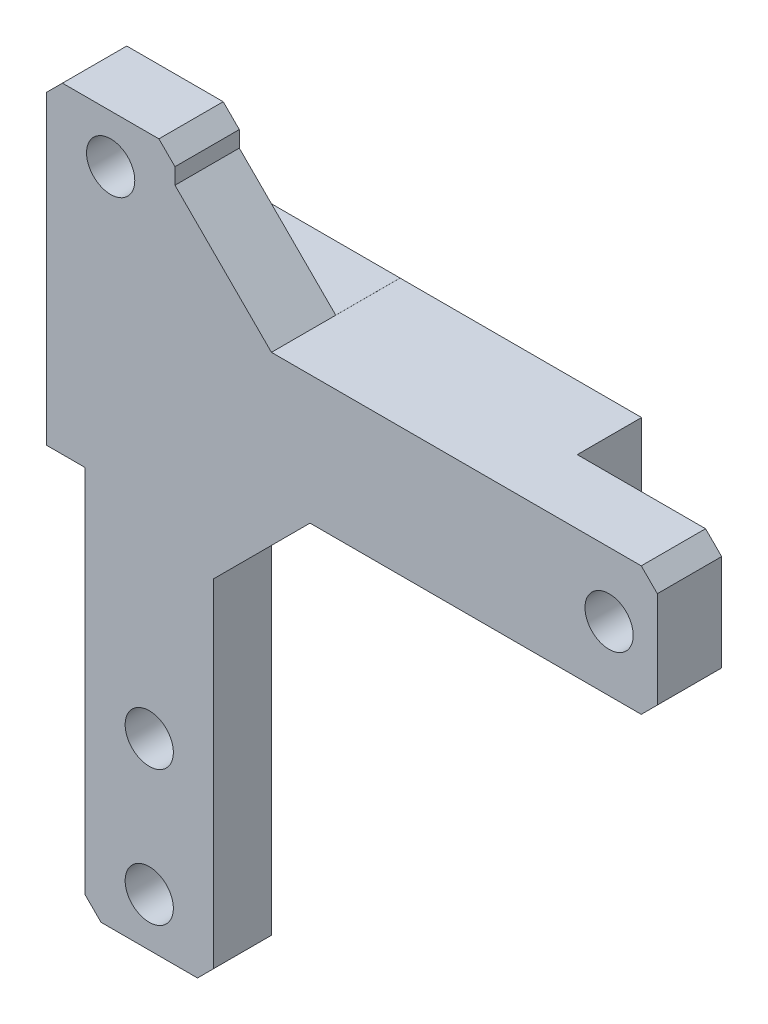
from build123d import *

# Parameters (mm, degrees)
SKETCH_1_R          = 0.75
EXTRUDE_1_DEPTH     = 4
SKETCH_2_W          = 4
SKETCH_2_H          = 11.631287185
SKETCH_2_R          = 0.75
CUT_EXTRUDE_1_DEPTH = 2.2
SKETCH_3_W          = 4.48994314
SKETCH_3_H          = 4
SKETCH_3_R          = 0.75
SKETCH_3_W_2        = 4
SKETCH_3_H_2        = 3.998874997
CUT_EXTRUDE_2_DEPTH = 2
CHAMFER_1_SIZE      = 3
CHAMFER_2_SIZE      = 0.5


with BuildPart() as part:
    # 草图1 → 凸台-拉伸1 (new body)
    with BuildSketch(Plane.XY):
        Polygon((-4.3, -2.5), (9.5, -2.5), (9.5, 1.5), (-5.5, 1.5), (-5.5, 5.5), (-9.5, 5.5), (-9.5, 1.5), (-9.5, -4.5), (-8.3, -4.5), (-8.3, -16.5), (-4.3, -16.5), align=None)
        with Locations((8, -0.5)):
            Circle(SKETCH_1_R, mode=Mode.SUBTRACT)
        with Locations((-7.5, 4)):
            Circle(SKETCH_1_R, mode=Mode.SUBTRACT)
        with Locations((-6.3, -15)):
            Circle(SKETCH_1_R, mode=Mode.SUBTRACT)
        with Locations((-6.3, -10.8)):
            Circle(SKETCH_1_R, mode=Mode.SUBTRACT)
    extrude(amount=EXTRUDE_1_DEPTH)

    # 草图2 → 切除-拉伸1 (cut)
    with BuildSketch(Plane.XY):
        with Locations((-6.3, -10.684356408)):
            Rectangle(SKETCH_2_W, SKETCH_2_H)
        with Locations((-6.3, -15)):
            Circle(SKETCH_2_R, mode=Mode.SUBTRACT)
        with Locations((-6.3, -10.8)):
            Circle(SKETCH_2_R, mode=Mode.SUBTRACT)
    extrude(amount=CUT_EXTRUDE_1_DEPTH, mode=Mode.SUBTRACT)

    # 草图3 → 切除-拉伸2 (cut)
    # profile 1 of 2: a face of its own
    with BuildSketch(Plane(origin=(0, 0, 0), x_dir=(-1, 0, 0), z_dir=(0, 0, -1))):
        with Locations((-7.25502843, -0.5)):
            Rectangle(SKETCH_3_W, SKETCH_3_H)
        with Locations((-8, -0.5)):
            Circle(SKETCH_3_R, mode=Mode.SUBTRACT)
    # profile 2 of 2: a face of its own
    with BuildSketch(Plane(origin=(0, 0, 0), x_dir=(-1, 0, 0), z_dir=(0, 0, -1))):
        with Locations((7.5, 3.500562502)):
            Rectangle(SKETCH_3_W_2, SKETCH_3_H_2)
        with Locations((7.5, 4)):
            Circle(SKETCH_3_R, mode=Mode.SUBTRACT)
    extrude(amount=-CUT_EXTRUDE_2_DEPTH, mode=Mode.SUBTRACT)

    # 倒角1
    chamfer_1_edges = [part.edges().sort_by_distance(p)[0] for p in [
        (-4.3, -2.5, 2),
        (-5.5, 1.5, 2),
    ]]
    chamfer(chamfer_1_edges, length=CHAMFER_1_SIZE)

    # 倒角2
    chamfer_2_edges = [part.edges().sort_by_distance(p)[0] for p in [
        (-4.3, -16.5, 3.1),
        (-8.3, -16.5, 3.1),
        (-9.5, 5.5, 3),
        (9.5, -2.5, 3),
        (9.5, 1.5, 3),
        (-5.5, 5.5, 3),
    ]]
    chamfer(chamfer_2_edges, length=CHAMFER_2_SIZE)


solid = part.part
